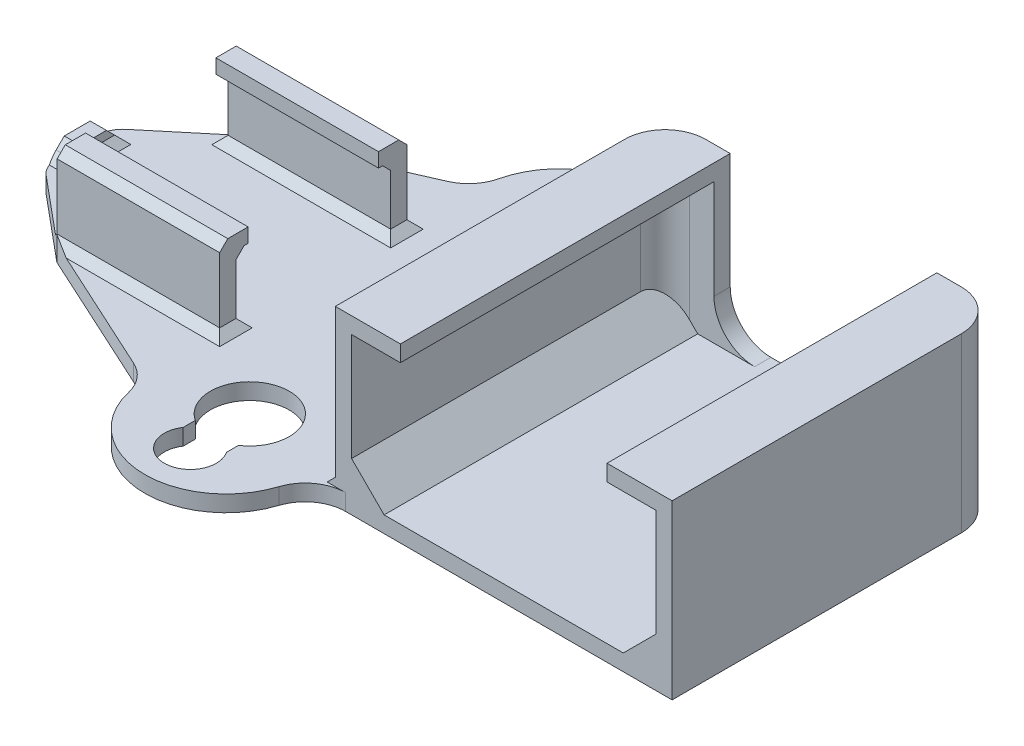
from build123d import *

# Parameters (mm, degrees)
BOSS_EXTRUDE3_DEPTH  = 2
SKETCH2_W            = 19.980275276
SKETCH2_H            = 2
BOSS_EXTRUDE4_DEPTH  = 10
SKETCH4_W            = 19.982686102
SKETCH4_H            = 1.75
BOSS_EXTRUDE6_DEPTH  = 1.5
SKETCH5_W            = 19.980275276
SKETCH5_H            = 1.75
BOSS_EXTRUDE7_DEPTH  = 1.5
SKETCH6_W            = 2
SKETCH6_H            = 40.546143633
BOSS_EXTRUDE8_DEPTH  = 19.2
SKETCH7_W            = 40.546143633
SKETCH7_H            = 2
BOSS_EXTRUDE9_DEPTH  = 6
SKETCH8_W            = 40.546143633
SKETCH8_H            = 2
BOSS_EXTRUDE10_DEPTH = 6
SKETCH9_W            = 2
SKETCH9_H            = 17.2
BOSS_EXTRUDE11_DEPTH = 6
SKETCH11_W           = 2
SKETCH11_H           = 17.2
BOSS_EXTRUDE12_DEPTH = 6
CHAMFER3_SIZE        = 1
FILLET6_R            = 3
FILLET12_R           = 5
FILLET13_R           = 5
CHAMFER4_SIZE        = 4
SKETCH12_W           = 2
SKETCH12_H           = 5.189750324
BOSS_EXTRUDE13_DEPTH = 2
CHAMFER5_SIZE        = 1


with BuildPart() as part:
    # Sketch1 → Boss-Extrude3 (new body)
    with BuildSketch(Plane(origin=(0, 0, 0), x_dir=(1, 0, 0), z_dir=(0, 1, 0))):
        with BuildLine():
            Line((-8.328383402, 17.178082192), (-11.926539406, 14.179618856))
            Line((-11.926539406, 14.179618856), (-16.248936601, 10.577621193))
            ThreePointArc((-16.248936601, 10.577621193), (-17.045151666, 9.545423543), (-17.328383402, 8.272957354))
            Line((-17.328383402, 8.272957354), (-17.328383402, 3.08320703))
            ThreePointArc((-17.328383402, 3.08320703), (-17.045151666, 1.810740841), (-16.248936601, 0.778543191))
            Line((-16.248936601, 0.778543191), (-11.926539406, -2.823454472))
            Line((-11.926539406, -2.823454472), (-8.328383402, -5.821917808))
            Line((-8.328383402, -5.821917808), (9.145578492, -13.850782578))
            ThreePointArc((9.145578492, -13.850782578), (10.93396709, -15.23549913), (11.929216114, -17.266571036))
            ThreePointArc((11.929216114, -17.266571036), (21.256400089, -25.002812312), (31.193312026, -18.067138506))
            ThreePointArc((31.193312026, -18.067138506), (33.007912602, -15.555233716), (35.954159741, -14.594989625))
            Line((35.954159741, -14.594989625), (36.671616598, -14.594989625))
            Line((36.671616598, -14.594989625), (76.071616598, -14.594989625))
            Line((76.071616598, -14.594989625), (76.071616598, 25.951154008))
            Line((76.071616598, 25.951154008), (36.671616598, 25.951154008))
            Line((36.671616598, 25.951154008), (35.805077068, 25.951154008))
            ThreePointArc((35.805077068, 25.951154008), (32.918325722, 26.868671104), (31.09103186, 29.284487342))
            ThreePointArc((31.09103186, 29.284487342), (21.121556826, 35.936488389), (11.929724224, 28.245600027))
            ThreePointArc((11.929724224, 28.245600027), (10.905359885, 26.19326698), (9.072373225, 24.814298837))
            Line((9.072373225, 24.814298837), (-8.328383402, 17.178082192))
        make_face()
        with BuildLine():
            Line((24.320629097, -16.144178085), (24.320629097, -17.62452967))
            ThreePointArc((24.320629097, -17.62452967), (21.662941444, -22.60685858), (19.005253792, -17.62452967))
            Line((19.005253792, -17.62452967), (19.005253792, -16.144178085))
            ThreePointArc((19.005253792, -16.144178085), (21.662941444, -7.256310151), (24.320629097, -16.144178085))
        make_face(mode=Mode.SUBTRACT)
        with BuildLine():
            Line((24.320629097, 24.348091169), (24.320629097, 22.867739584))
            ThreePointArc((24.320629097, 22.867739584), (21.662941444, 17.885410674), (19.005253792, 22.867739584))
            Line((19.005253792, 22.867739584), (19.005253792, 24.348091169))
            ThreePointArc((19.005253792, 24.348091169), (21.662941444, 33.235959102), (24.320629097, 24.348091169))
        make_face(mode=Mode.SUBTRACT)
    extrude(amount=BOSS_EXTRUDE3_DEPTH)

    # Sketch2 → Boss-Extrude4 (add)
    with BuildSketch(Plane(origin=(0, 2, 0), x_dir=(1, 0, 0), z_dir=(0, 1, 0))):
        Polygon((11.6543027, 15.226428568), (11.6543027, 17.226428568), (-8.218215819, 17.226428568), (-8.328383402, 17.178082192), (-8.328383402, 15.226428568), align=None)
        with Locations((1.661754236, -4.792288058)):
            Rectangle(SKETCH2_W, SKETCH2_H)
    extrude(amount=BOSS_EXTRUDE4_DEPTH)

    # Sketch4 → Boss-Extrude6 (add)
    with BuildSketch(Plane.XY.offset(-15.226428568)):
        with Locations((1.662959649, 11.125)):
            Rectangle(SKETCH4_W, SKETCH4_H)
    extrude(amount=BOSS_EXTRUDE6_DEPTH)

    # Sketch5 → Boss-Extrude7 (add)
    with BuildSketch(Plane(origin=(0, 0, 3.792288058), x_dir=(-1, 0, 0), z_dir=(0, 0, -1))):
        with Locations((-1.661754236, 11.125)):
            Rectangle(SKETCH5_W, SKETCH5_H)
    extrude(amount=BOSS_EXTRUDE7_DEPTH)

    # Sketch6 → Boss-Extrude8 (add)
    with BuildSketch(Plane(origin=(0, 2, 0), x_dir=(1, 0, 0), z_dir=(0, 1, 0))):
        with Locations((35.671616598, 5.678082192)):
            Rectangle(SKETCH6_W, SKETCH6_H)
        with Locations((75.071616598, 5.678082192)):
            Rectangle(SKETCH6_W, SKETCH6_H)
    extrude(amount=BOSS_EXTRUDE8_DEPTH)

    # Sketch7 → Boss-Extrude9 (add)
    with BuildSketch(Plane.ZY.offset(-74.071616598)):
        with Locations((-5.678082192, 20.2)):
            Rectangle(SKETCH7_W, SKETCH7_H)
    extrude(amount=BOSS_EXTRUDE9_DEPTH)

    # Sketch8 → Boss-Extrude10 (add)
    with BuildSketch(Plane(origin=(36.671616598, 0, 0), x_dir=(0, 0, -1), z_dir=(1, 0, 0))):
        with Locations((5.678082192, 20.2)):
            Rectangle(SKETCH8_W, SKETCH8_H)
    extrude(amount=BOSS_EXTRUDE10_DEPTH)

    # Sketch9 → Boss-Extrude11 (add)
    with BuildSketch(Plane(origin=(36.671616598, 0, 0), x_dir=(0, 0, -1), z_dir=(1, 0, 0))):
        with Locations((24.951154008, 10.6)):
            Rectangle(SKETCH9_W, SKETCH9_H)
    extrude(amount=BOSS_EXTRUDE11_DEPTH)

    # Sketch11 → Boss-Extrude12 (add)
    with BuildSketch(Plane.ZY.offset(-74.071616598)):
        with Locations((-24.951154008, 10.6)):
            Rectangle(SKETCH11_W, SKETCH11_H)
    extrude(amount=BOSS_EXTRUDE12_DEPTH)

    # Chamfer3
    # the kernel refuses this chamfer: 1 mm, written as the material it adds along each edge
    with BuildSketch(Plane(origin=(34.671616598, 2, -25.951154008), x_dir=(-1, 0, 0), z_dir=(0, 0, 1))) as chamfer3_piece_1:
        Polygon((CHAMFER3_SIZE, 0), (0, -CHAMFER3_SIZE), (0, 0), align=None)
    extrude(amount=40.546143633)
    with BuildSketch(Plane(origin=(11.651891874, 2, 5.792288058), x_dir=(0, 0, 1), z_dir=(-1, 0, 0))) as chamfer3_piece_2_section:
        Polygon((CHAMFER3_SIZE, 0), (0, CHAMFER3_SIZE), (0, 0), align=None)
    chamfer3_piece_2 = extrude(amount=19.980275276, mode=Mode.PRIVATE)
    chamfer3_piece_2 = split(chamfer3_piece_2, bisect_by=Plane(origin=(8.15775509, 2, 13.396901508), z_dir=(0.4175125238289849, 0, -0.9086711684905334)), keep=Keep.TOP, mode=Mode.PRIVATE)
    add(chamfer3_piece_2)
    with BuildSketch(Plane(origin=(11.6543027, 2, -17.226428568), x_dir=(0, 0, -1), z_dir=(-1, 0, 0))) as chamfer3_piece_3_section:
        Polygon((CHAMFER3_SIZE, 0), (0, -CHAMFER3_SIZE), (0, 0), align=None)
    chamfer3_piece_3 = extrude(amount=22.444201507, mode=Mode.PRIVATE)
    chamfer3_piece_3 = split(chamfer3_piece_3, bisect_by=Plane(origin=(8.445196081, 2, -24.539065946), z_dir=(0.40185152236711835, 0, 0.9157048399846042)), keep=Keep.TOP, mode=Mode.PRIVATE)
    add(chamfer3_piece_3)

    # Fillet6
    fillet6_edges = [part.edges().sort_by_distance(p)[0] for p in [
        (36.671616598, 10.6, -23.951154008),
        (74.071616598, 10.6, -23.951154008),
    ]]
    fillet(fillet6_edges, radius=FILLET6_R)

    # Fillet12
    fillet12_edges = [part.edges().sort_by_distance(p)[0] for p in [
        (34.671616598, 12.1, -25.951154008),
        (76.071616598, 10.6, -25.951154008),
    ]]
    fillet(fillet12_edges, radius=FILLET12_R)

    # Fillet13
    fillet13_edges = [part.edges().sort_by_distance(p)[0] for p in [
        (42.671616598, 2, -24.951154008),
        (68.071616598, 2, -24.951154008),
    ]]
    fillet(fillet13_edges, radius=FILLET13_R)

    # Chamfer4
    # the kernel refuses this chamfer: 4 mm, written as the material it adds along each edge
    with BuildSketch(Plane(origin=(74.071616598, 2, -31.23788596), x_dir=(-1, 0, 0), z_dir=(0, 0, 1))) as chamfer4_piece_1_section:
        Polygon((CHAMFER4_SIZE, 0), (0, -CHAMFER4_SIZE), (0, 0), align=None)
    chamfer4_piece_1 = extrude(amount=45.832875585, mode=Mode.PRIVATE)
    chamfer4_piece_1 = split(chamfer4_piece_1, bisect_by=Plane(origin=(74.071616598, 2, -23.951154008), z_dir=(0, 0, 1)), keep=Keep.TOP, mode=Mode.PRIVATE)
    add(chamfer4_piece_1)
    with BuildSketch(Plane(origin=(36.671616598, 2, 14.594989625), x_dir=(1, 0, 0), z_dir=(0, 0, -1))) as chamfer4_piece_2_section:
        Polygon((CHAMFER4_SIZE, 0), (0, -CHAMFER4_SIZE), (0, 0), align=None)
    chamfer4_piece_2 = extrude(amount=45.832875585, mode=Mode.PRIVATE)
    chamfer4_piece_2 = split(chamfer4_piece_2, bisect_by=Plane(origin=(36.671616598, 2, -23.951154008), z_dir=(0, 0, 1)), keep=Keep.TOP, mode=Mode.PRIVATE)
    add(chamfer4_piece_2)

    # Sketch12 → Boss-Extrude13 (add)
    with BuildSketch(Plane(origin=(0, 2, 0), x_dir=(1, 0, 0), z_dir=(0, 1, 0))):
        with Locations((-16.328383402, 5.678082192)):
            Rectangle(SKETCH12_W, SKETCH12_H)
    extrude(amount=BOSS_EXTRUDE13_DEPTH)

    # Chamfer5
    # the kernel refuses this chamfer: 1 mm, written as the material it adds along each edge
    with BuildSketch(Plane(origin=(11.651891874, 10.25, 3.792288058), x_dir=(0, -1, 0), z_dir=(-1, 0, 0))) as chamfer5_piece_1:
        Polygon((CHAMFER5_SIZE, 0), (0, -CHAMFER5_SIZE), (0, 0), align=None)
    extrude(amount=19.980275276)
    with BuildSketch(Plane(origin=(11.6543027, 10.25, -15.226428568), x_dir=(0, -1, 0), z_dir=(-1, 0, 0))) as chamfer5_piece_2:
        Polygon((CHAMFER5_SIZE, 0), (0, CHAMFER5_SIZE), (0, 0), align=None)
    extrude(amount=19.982686102)
    with BuildSketch(Plane(origin=(11.6543027, 2, -15.226428568), x_dir=(1, 0, 0), z_dir=(0, 0, -1))) as chamfer5_piece_3_section:
        Polygon((CHAMFER5_SIZE, 0), (0, -CHAMFER5_SIZE), (0, 0), align=None)
    chamfer5_piece_3 = extrude(amount=5.571682988, mode=Mode.PRIVATE)
    chamfer5_piece_3 = split(chamfer5_piece_3, bisect_by=Plane(origin=(11.6543027, 3.5, -16.726428568), z_dir=(0, -0.7071067811865476, 0.7071067811865476)), keep=Keep.TOP, mode=Mode.PRIVATE)
    add(chamfer5_piece_3)
    with BuildSketch(Plane(origin=(-8.328383402, 2, -15.226428568), x_dir=(0, 0, 1), z_dir=(1, 0, 0))) as chamfer5_piece_4:
        Polygon((CHAMFER5_SIZE, 0), (0, -CHAMFER5_SIZE), (0, 0), align=None)
    extrude(amount=19.982686102)
    with BuildSketch(Plane(origin=(-8.328383402, 2, -19.74976518), x_dir=(-1, 0, 0), z_dir=(0, 0, 1))) as chamfer5_piece_5_section:
        Polygon((CHAMFER5_SIZE, 0), (0, -CHAMFER5_SIZE), (0, 0), align=None)
    chamfer5_piece_5 = extrude(amount=4.523336611, mode=Mode.PRIVATE)
    chamfer5_piece_5 = split(chamfer5_piece_5, bisect_by=Plane(origin=(-7.063621277, 2, -18.232050629), z_dir=(0.6401843996644802, 0, 0.7682212795973757)), keep=Keep.TOP, mode=Mode.PRIVATE)
    add(chamfer5_piece_5)
    with BuildSketch(Plane(origin=(11.651891874, 2, 9.363971046), x_dir=(1, 0, 0), z_dir=(0, 0, -1))) as chamfer5_piece_6_section:
        Polygon((CHAMFER5_SIZE, 0), (0, -CHAMFER5_SIZE), (0, 0), align=None)
    chamfer5_piece_6 = extrude(amount=5.571682988, mode=Mode.PRIVATE)
    chamfer5_piece_6 = split(chamfer5_piece_6, bisect_by=Plane(origin=(11.651891874, 0.714158506, 8.078129552), z_dir=(0, -0.7071067811865476, -0.7071067811865476)), keep=Keep.TOP, mode=Mode.PRIVATE)
    add(chamfer5_piece_6)
    with BuildSketch(Plane(origin=(-8.328383402, 2, 3.792288058), x_dir=(-1, 0, 0), z_dir=(0, 0, 1))) as chamfer5_piece_7_section:
        Polygon((CHAMFER5_SIZE, 0), (0, -CHAMFER5_SIZE), (0, 0), align=None)
    chamfer5_piece_7 = extrude(amount=4.601312738, mode=Mode.PRIVATE)
    chamfer5_piece_7 = split(chamfer5_piece_7, bisect_by=Plane(origin=(-8.328383402, 3.5, 5.292288058), z_dir=(0, -0.7071067811865476, -0.7071067811865476)), keep=Keep.TOP, mode=Mode.PRIVATE)
    chamfer5_piece_7 = split(chamfer5_piece_7, bisect_by=Plane(origin=(-9.326561968, 2, 4.990102337), z_dir=(0.6401843996644799, 0, -0.7682212795973757)), keep=Keep.TOP, mode=Mode.PRIVATE)
    add(chamfer5_piece_7)
    with BuildSketch(Plane(origin=(-8.328383402, 2, 3.792288058), x_dir=(0, 0, -1), z_dir=(1, 0, 0))) as chamfer5_piece_8:
        Polygon((CHAMFER5_SIZE, 0), (0, CHAMFER5_SIZE), (0, 0), align=None)
    extrude(amount=19.980275276)
    with BuildSketch(Plane(origin=(-19.90006639, 2, -8.272957354), x_dir=(0, 0, -1), z_dir=(1, 0, 0))) as chamfer5_piece_9_section:
        Polygon((CHAMFER5_SIZE, 0), (0, CHAMFER5_SIZE), (0, 0), align=None)
    chamfer5_piece_9 = extrude(amount=4.571682988, mode=Mode.PRIVATE)
    chamfer5_piece_9 = chamfer5_piece_9 & Plane(origin=(-14.328383402, 2, -8.272957354), x_dir=(-0.6401843996644775, 0, -0.7682212795973778), z_dir=(0, -1, 0)) * Cylinder(3, 14, mode=Mode.PRIVATE)
    add(chamfer5_piece_9)
    with BuildSketch(Plane(origin=(-15.328383402, 2, -8.272957354), x_dir=(1, 0, 0), z_dir=(0, 0, 1))) as chamfer5_piece_10:
        Polygon((CHAMFER5_SIZE, 0), (0, CHAMFER5_SIZE), (0, 0), align=None)
    extrude(amount=5.189750324)
    with BuildSketch(Plane(origin=(-15.328383402, 2, -3.08320703), x_dir=(0, 0, 1), z_dir=(-1, 0, 0))) as chamfer5_piece_11_section:
        Polygon((CHAMFER5_SIZE, 0), (0, CHAMFER5_SIZE), (0, 0), align=None)
    chamfer5_piece_11 = extrude(amount=4.571682988, mode=Mode.PRIVATE)
    chamfer5_piece_11 = chamfer5_piece_11 & Plane(origin=(-14.328383402, 2, -3.08320703), x_dir=(-1, 0, 0), z_dir=(0, -1, 0)) * Cylinder(3, 14, mode=Mode.PRIVATE)
    add(chamfer5_piece_11)
    with BuildSketch(Plane(origin=(-8.328383402, 2, -15.226428568), x_dir=(0, 0, 1), z_dir=(1, 0, 0))) as chamfer5_piece_12a_section:
        Polygon((CHAMFER5_SIZE, 0), (0, -CHAMFER5_SIZE), (0, 0), align=None)
    chamfer5_piece_12a = extrude(amount=22.55436909, mode=Mode.PRIVATE)
    chamfer5_piece_12a = split(chamfer5_piece_12a, bisect_by=Plane(origin=(11.6543027, 2, -15.226428568), z_dir=(1, 0, 0)), keep=Keep.TOP, mode=Mode.PRIVATE)
    with BuildSketch(Plane(origin=(11.6543027, 2, -12.65474558), x_dir=(1, 0, 0), z_dir=(0, 0, -1))) as chamfer5_piece_12b_section:
        Polygon((CHAMFER5_SIZE, 0), (0, -CHAMFER5_SIZE), (0, 0), align=None)
    chamfer5_piece_12b = extrude(amount=8.143365976, mode=Mode.PRIVATE)
    chamfer5_piece_12b = split(chamfer5_piece_12b, bisect_by=Plane(origin=(11.6543027, 2, -15.226428568), z_dir=(0, 0, 1)), keep=Keep.TOP, mode=Mode.PRIVATE)
    chamfer5_piece_12 = chamfer5_piece_12a & chamfer5_piece_12b
    add(chamfer5_piece_12)
    with BuildSketch(Plane(origin=(-8.328383402, 2, -19.74976518), x_dir=(-1, 0, 0), z_dir=(0, 0, 1))) as chamfer5_piece_13a_section:
        Polygon((CHAMFER5_SIZE, 0), (0, -CHAMFER5_SIZE), (0, 0), align=None)
    chamfer5_piece_13a = extrude(amount=7.095019599, mode=Mode.PRIVATE)
    chamfer5_piece_13a = split(chamfer5_piece_13a, bisect_by=Plane(origin=(-8.328383402, 2, -15.226428568), z_dir=(0, 0, 1)), keep=Keep.TOP, mode=Mode.PRIVATE)
    with BuildSketch(Plane(origin=(-10.90006639, 2, -15.226428568), x_dir=(0, 0, 1), z_dir=(1, 0, 0))) as chamfer5_piece_13b_section:
        Polygon((CHAMFER5_SIZE, 0), (0, -CHAMFER5_SIZE), (0, 0), align=None)
    chamfer5_piece_13b = extrude(amount=22.55436909, mode=Mode.PRIVATE)
    chamfer5_piece_13b = split(chamfer5_piece_13b, bisect_by=Plane(origin=(-10.805927603, 2, -15.113462024), z_dir=(0.6401843996644802, 0, 0.7682212795973757)), keep=Keep.TOP, mode=Mode.PRIVATE)
    chamfer5_piece_13b = split(chamfer5_piece_13b, bisect_by=Plane(origin=(-8.328383402, 2, -15.226428568), z_dir=(-1, 0, 0)), keep=Keep.TOP, mode=Mode.PRIVATE)
    chamfer5_piece_13 = chamfer5_piece_13a & chamfer5_piece_13b
    add(chamfer5_piece_13)
    with BuildSketch(Plane(origin=(11.651891874, 2, 9.363971046), x_dir=(1, 0, 0), z_dir=(0, 0, -1))) as chamfer5_piece_14a_section:
        Polygon((CHAMFER5_SIZE, 0), (0, -CHAMFER5_SIZE), (0, 0), align=None)
    chamfer5_piece_14a = extrude(amount=8.143365976, mode=Mode.PRIVATE)
    chamfer5_piece_14a = split(chamfer5_piece_14a, bisect_by=Plane(origin=(11.651891874, 2, 3.792288058), z_dir=(0, 0, -1)), keep=Keep.TOP, mode=Mode.PRIVATE)
    with BuildSketch(Plane(origin=(-8.328383402, 2, 3.792288058), x_dir=(0, 0, -1), z_dir=(1, 0, 0))) as chamfer5_piece_14b_section:
        Polygon((CHAMFER5_SIZE, 0), (0, CHAMFER5_SIZE), (0, 0), align=None)
    chamfer5_piece_14b = extrude(amount=22.551958264, mode=Mode.PRIVATE)
    chamfer5_piece_14b = split(chamfer5_piece_14b, bisect_by=Plane(origin=(11.651891874, 2, 3.792288058), z_dir=(1, 0, 0)), keep=Keep.TOP, mode=Mode.PRIVATE)
    chamfer5_piece_14 = chamfer5_piece_14a & chamfer5_piece_14b
    add(chamfer5_piece_14)
    with BuildSketch(Plane(origin=(-10.90006639, 2, 3.792288058), x_dir=(0, 0, -1), z_dir=(1, 0, 0))) as chamfer5_piece_15a_section:
        Polygon((CHAMFER5_SIZE, 0), (0, CHAMFER5_SIZE), (0, 0), align=None)
    chamfer5_piece_15a = extrude(amount=22.551958264, mode=Mode.PRIVATE)
    chamfer5_piece_15a = split(chamfer5_piece_15a, bisect_by=Plane(origin=(-8.328383402, 2, 3.792288058), z_dir=(-1, 0, 0)), keep=Keep.TOP, mode=Mode.PRIVATE)
    chamfer5_piece_15a = split(chamfer5_piece_15a, bisect_by=Plane(origin=(-10.844276518, 2, 3.725340212), z_dir=(0.6401843996644799, 0, -0.7682212795973757)), keep=Keep.TOP, mode=Mode.PRIVATE)
    with BuildSketch(Plane(origin=(-8.328383402, 2, 1.22060507), x_dir=(-1, 0, 0), z_dir=(0, 0, 1))) as chamfer5_piece_15b_section:
        Polygon((CHAMFER5_SIZE, 0), (0, -CHAMFER5_SIZE), (0, 0), align=None)
    chamfer5_piece_15b = extrude(amount=7.172995726, mode=Mode.PRIVATE)
    chamfer5_piece_15b = split(chamfer5_piece_15b, bisect_by=Plane(origin=(-8.328383402, 2, 3.792288058), z_dir=(0, 0, -1)), keep=Keep.TOP, mode=Mode.PRIVATE)
    chamfer5_piece_15 = chamfer5_piece_15a & chamfer5_piece_15b
    add(chamfer5_piece_15)
    with BuildSketch(Plane(origin=(-15.328383402, 2, -10.844640342), x_dir=(1, 0, 0), z_dir=(0, 0, 1))) as chamfer5_piece_16a_section:
        Polygon((CHAMFER5_SIZE, 0), (0, CHAMFER5_SIZE), (0, 0), align=None)
    chamfer5_piece_16a = extrude(amount=7.761433312, mode=Mode.PRIVATE)
    chamfer5_piece_16a = split(chamfer5_piece_16a, bisect_by=Plane(origin=(-15.328383402, 2, -8.272957354), z_dir=(0, 0, -1)), keep=Keep.TOP, mode=Mode.PRIVATE)
    with BuildSketch(Plane(origin=(-17.328383402, 2, -8.272957354), x_dir=(0, 0, -1), z_dir=(1, 0, 0))) as chamfer5_piece_16b_section:
        Polygon((CHAMFER5_SIZE, 0), (0, CHAMFER5_SIZE), (0, 0), align=None)
    chamfer5_piece_16b = extrude(amount=4.571682988, mode=Mode.PRIVATE)
    chamfer5_piece_16b = split(chamfer5_piece_16b, bisect_by=Plane(origin=(-15.328383402, 2, -8.272957354), z_dir=(1, 0, 0)), keep=Keep.TOP, mode=Mode.PRIVATE)
    chamfer5_piece_16 = chamfer5_piece_16a & chamfer5_piece_16b
    add(chamfer5_piece_16)
    with BuildSketch(Plane(origin=(-12.756700414, 2, -3.08320703), x_dir=(0, 0, 1), z_dir=(-1, 0, 0))) as chamfer5_piece_17a_section:
        Polygon((CHAMFER5_SIZE, 0), (0, CHAMFER5_SIZE), (0, 0), align=None)
    chamfer5_piece_17a = extrude(amount=4.571682988, mode=Mode.PRIVATE)
    chamfer5_piece_17a = split(chamfer5_piece_17a, bisect_by=Plane(origin=(-15.328383402, 2, -3.08320703), z_dir=(1, 0, 0)), keep=Keep.TOP, mode=Mode.PRIVATE)
    with BuildSketch(Plane(origin=(-15.328383402, 2, -8.272957354), x_dir=(1, 0, 0), z_dir=(0, 0, 1))) as chamfer5_piece_17b_section:
        Polygon((CHAMFER5_SIZE, 0), (0, CHAMFER5_SIZE), (0, 0), align=None)
    chamfer5_piece_17b = extrude(amount=7.761433312, mode=Mode.PRIVATE)
    chamfer5_piece_17b = split(chamfer5_piece_17b, bisect_by=Plane(origin=(-15.328383402, 2, -3.08320703), z_dir=(0, 0, 1)), keep=Keep.TOP, mode=Mode.PRIVATE)
    chamfer5_piece_17 = chamfer5_piece_17a & chamfer5_piece_17b
    add(chamfer5_piece_17)
    # the kernel refuses this chamfer: 1 mm, written as the material it takes off along each edge
    with BuildSketch(Plane(origin=(14.225985688, 12, -17.226428568), x_dir=(0, -1, 0), z_dir=(-1, 0, 0))) as chamfer5_2_piece_1:
        Polygon((CHAMFER5_SIZE, 0), (0, CHAMFER5_SIZE), (0, 0), align=None)
    extrude(amount=25.015884495, mode=Mode.SUBTRACT)
    with BuildSketch(Plane(origin=(14.223574861, 12, 5.792288058), x_dir=(0, -1, 0), z_dir=(-1, 0, 0))) as chamfer5_2_piece_2:
        Polygon((CHAMFER5_SIZE, 0), (0, -CHAMFER5_SIZE), (0, 0), align=None)
    extrude(amount=25.123641252, mode=Mode.SUBTRACT)
    with BuildSketch(Plane(origin=(-12.756700414, 4, -3.08320703), x_dir=(0, -1, 0), z_dir=(-1, 0, 0))) as chamfer5_2_piece_3:
        Polygon((CHAMFER5_SIZE, 0), (0, -CHAMFER5_SIZE), (0, 0), align=None)
    extrude(amount=7.143365976, mode=Mode.SUBTRACT)
    with BuildSketch(Plane(origin=(-19.90006639, 4, -8.272957354), x_dir=(0, 0, 1), z_dir=(1, 0, 0))) as chamfer5_2_piece_4:
        Polygon((CHAMFER5_SIZE, 0), (0, CHAMFER5_SIZE), (0, 0), align=None)
    extrude(amount=7.143365976, mode=Mode.SUBTRACT)


solid = part.part
